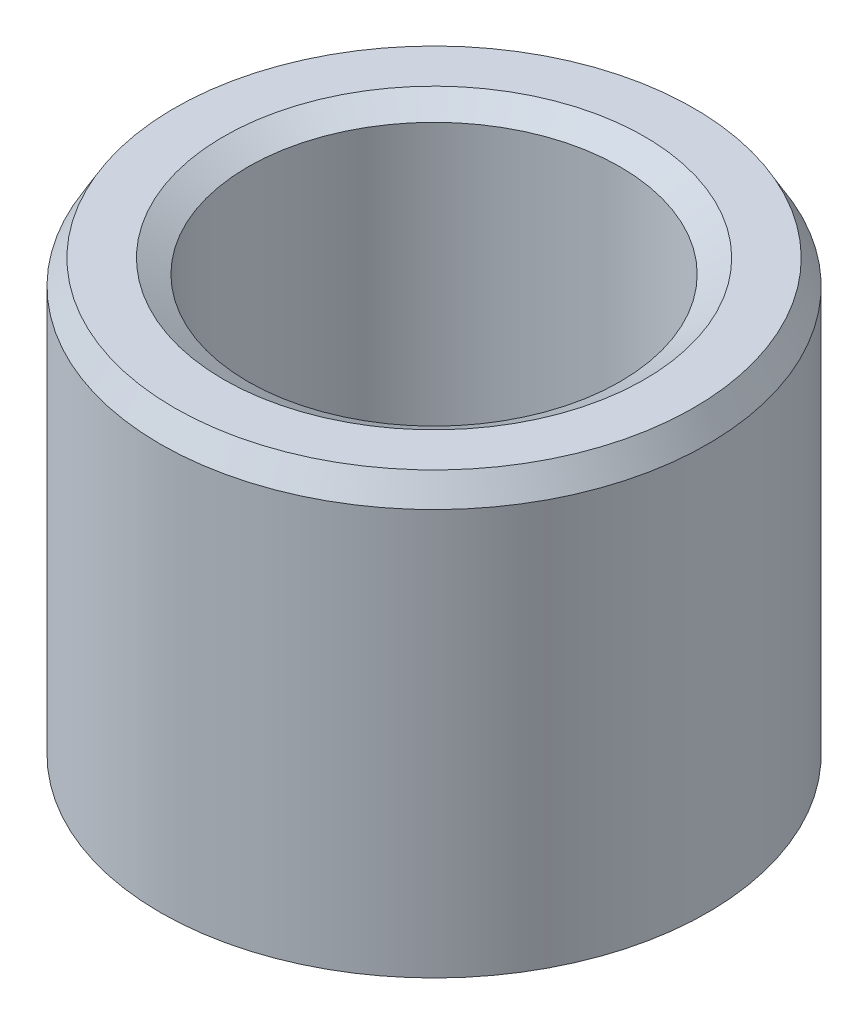
from build123d import *
from OCP.BRepFilletAPI import BRepFilletAPI_MakeChamfer

# Parameters (mm, degrees)
SKETCH1_R           = 10
BOSS_EXTRUDE1_DEPTH = 16.22494489
SKETCH2_R           = 6.798451404
CUT_EXTRUDE1_DEPTH  = 22.523216226
CHAMFER1_SIZE       = 0.890688613
CHAMFER1_SIZE2      = 0.514239311


with BuildPart() as part:
    # Sketch1 → Boss-Extrude1 (new body)
    with BuildSketch(Plane(origin=(0, 0, 0), x_dir=(1, 0, 0), z_dir=(0, 1, 0))):
        Circle(SKETCH1_R)
    extrude(amount=BOSS_EXTRUDE1_DEPTH)

    # Sketch2 → Cut-Extrude1 (cut, through all)
    with BuildSketch(Plane(origin=(0, 0, 0), x_dir=(1, 0, 0), z_dir=(0, 1, 0))):
        Circle(SKETCH2_R)
    extrude(amount=CUT_EXTRUDE1_DEPTH, mode=Mode.SUBTRACT)

    # Chamfer1: one chamfer whose edges measure the first distance from different faces: ONE call of the kernel's chamfer builder (chamfer() names one face for all edges)
    chamfer1_edges_1 = [part.edges().sort_by_distance(p)[0] for p in [
        (-6.798451404, 16.22494489, 0),
    ]]
    chamfer1_side_1 = [part.faces().sort_by_distance(p)[0] for p in [
        (-9.717157288, 16.22494489, 0),
    ]]
    chamfer1_edges_2 = [part.edges().sort_by_distance(p)[0] for p in [
        (-6.798451404, 0, 0),
    ]]
    chamfer1_side_2 = [part.faces().sort_by_distance(p)[0] for p in [
        (-6.798451404, 8.112472445, 0),
    ]]
    chamfer1_edges_3 = [part.edges().sort_by_distance(p)[0] for p in [
        (-10, 0, 0),
    ]]
    chamfer1_side_3 = [part.faces().sort_by_distance(p)[0] for p in [
        (-9.717157288, 0, 0),
    ]]
    chamfer1_edges_4 = [part.edges().sort_by_distance(p)[0] for p in [
        (-10, 16.22494489, 0),
    ]]
    chamfer1_side_4 = [part.faces().sort_by_distance(p)[0] for p in [
        (-10, 8.112472445, 0),
    ]]
    chamfer1 = BRepFilletAPI_MakeChamfer(part.part.solid().wrapped)
    for e in chamfer1_edges_1:
        chamfer1.Add(CHAMFER1_SIZE, CHAMFER1_SIZE2, e.wrapped, chamfer1_side_1[0].wrapped)  # the first distance lies on this face
    for e in chamfer1_edges_2:
        chamfer1.Add(CHAMFER1_SIZE, CHAMFER1_SIZE2, e.wrapped, chamfer1_side_2[0].wrapped)  # the first distance lies on this face
    for e in chamfer1_edges_3:
        chamfer1.Add(CHAMFER1_SIZE, CHAMFER1_SIZE2, e.wrapped, chamfer1_side_3[0].wrapped)  # the first distance lies on this face
    for e in chamfer1_edges_4:
        chamfer1.Add(CHAMFER1_SIZE, CHAMFER1_SIZE2, e.wrapped, chamfer1_side_4[0].wrapped)  # the first distance lies on this face
    add(Compound.cast(chamfer1.Shape()), mode=Mode.REPLACE)


solid = part.part
